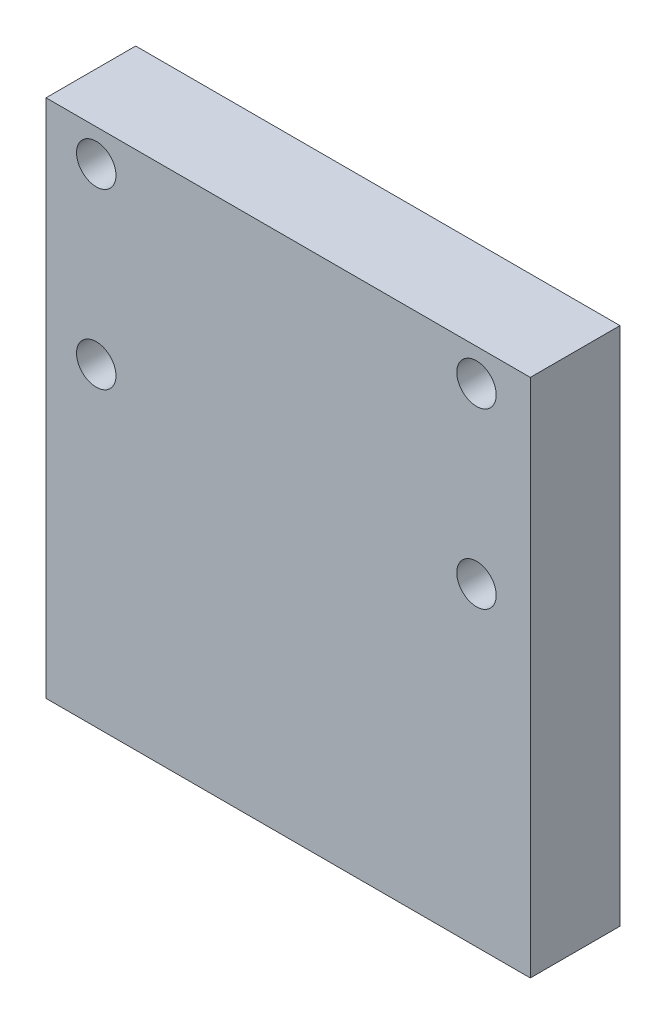
from build123d import *

# Parameters (mm, degrees)
SKETCH1_W           = 27
SKETCH1_H           = 29
BOSS_EXTRUDE1_DEPTH = 5
SKETCH2_R           = 1.25
CUT_EXTRUDE1_DEPTH  = 5
SKETCH3_R           = 1.1
CUT_EXTRUDE2_DEPTH  = 10


with BuildPart() as part:
    # Sketch1 → Boss-Extrude1 (new body)
    with BuildSketch(Plane.XY):
        Rectangle(SKETCH1_W, SKETCH1_H)
    extrude(amount=BOSS_EXTRUDE1_DEPTH)

    # Sketch2 → Cut-Extrude1 (cut)
    with BuildSketch(Plane.XZ.offset(14.5)):
        with Locations((-7, 2.5)):
            Circle(SKETCH2_R)
        with Locations((0, 2.5)):
            Circle(SKETCH2_R)
        with Locations((7, 2.5)):
            Circle(SKETCH2_R)
    extrude(amount=-CUT_EXTRUDE1_DEPTH, mode=Mode.SUBTRACT)

    # Sketch3 → Cut-Extrude2 (cut)
    with BuildSketch(Plane.XY.offset(5)):
        with Locations((-10.7, 12.7)):
            Circle(SKETCH3_R)
        with Locations((10.5, 12.7)):
            Circle(SKETCH3_R)
        with Locations((-10.7, 3.025)):
            Circle(SKETCH3_R)
        with Locations((10.5, 3.025)):
            Circle(SKETCH3_R)
    extrude(amount=-CUT_EXTRUDE2_DEPTH, mode=Mode.SUBTRACT)


solid = part.part
